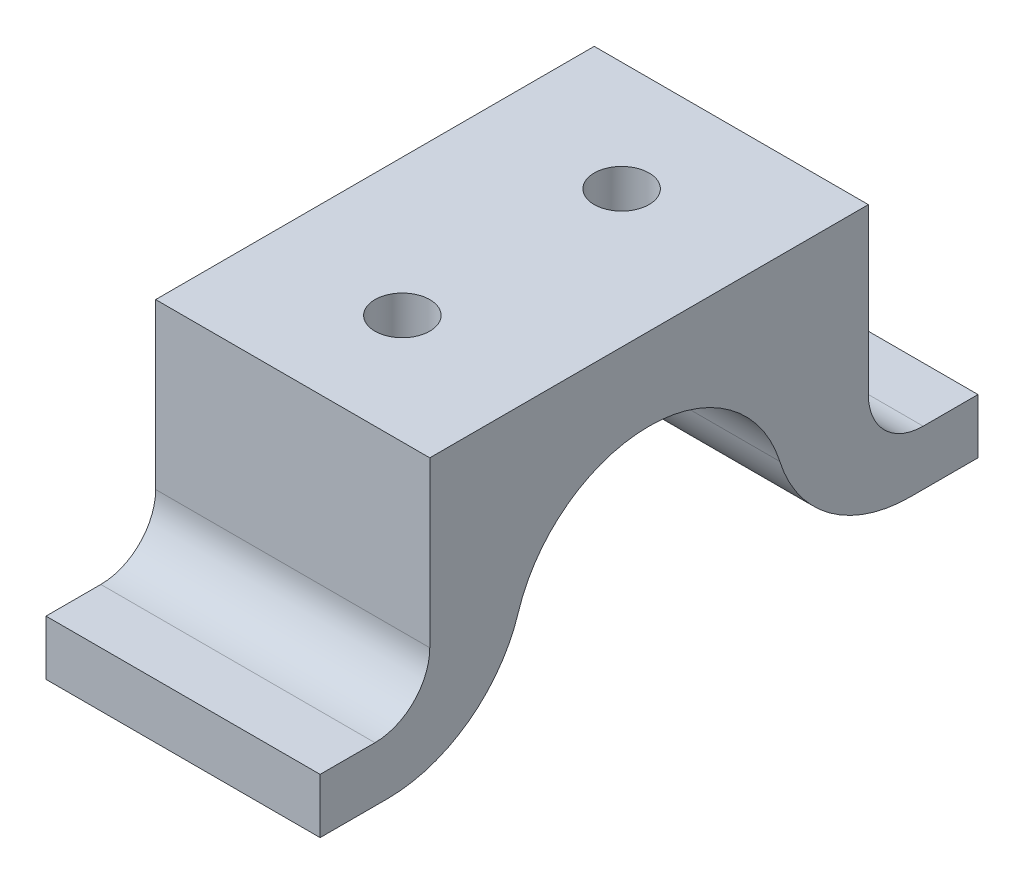
from build123d import *

# Parameters (mm, degrees)
SKETCH1_W           = 10
SKETCH1_H           = 16
BOSS_EXTRUDE1_DEPTH = 3
SKETCH2_W           = 10
SKETCH2_H           = 3
BOSS_EXTRUDE2_DEPTH = 5
SKETCH3_W           = 10
SKETCH3_H           = 7
BOSS_EXTRUDE3_DEPTH = 2
FILLET1_R           = 5
FILLET2_R           = 5
FILLET3_R           = 2
SKETCH4_R           = 1
CUT_EXTRUDE1_DEPTH  = 19.309833585


with BuildPart() as part:
    # Sketch1 → Boss-Extrude1 (new body)
    with BuildSketch(Plane.XZ.offset(-25)):
        with Locations((0, 2.5)):
            Rectangle(SKETCH1_W, SKETCH1_H)
    extrude(amount=BOSS_EXTRUDE1_DEPTH)

    # Sketch2 → Boss-Extrude2 (add)
    with BuildSketch(Plane.XZ.offset(-22)):
        with Locations((0, -4)):
            Rectangle(SKETCH2_W, SKETCH2_H)
        with Locations((0, 9)):
            Rectangle(SKETCH2_W, SKETCH2_H)
    extrude(amount=BOSS_EXTRUDE2_DEPTH)

    # Sketch3 → Boss-Extrude3 (add)
    with BuildSketch(Plane.XZ.offset(-17)):
        with Locations((0, 11)):
            Rectangle(SKETCH3_W, SKETCH3_H)
        with Locations((0, -6)):
            Rectangle(SKETCH3_W, SKETCH3_H)
    extrude(amount=BOSS_EXTRUDE3_DEPTH)

    # Fillet1
    fillet1_edges = [part.edges().sort_by_distance(p)[0] for p in [
        (0, 22, 7.5),
        (0, 22, -2.5),
    ]]
    fillet(fillet1_edges, radius=FILLET1_R - 0.0001)  # a hair under: the kernel refuses the full size

    # Fillet2
    fillet2_edges = [part.edges().sort_by_distance(p)[0] for p in [
        (0, 15, -2.5),
        (0, 15, 7.5),
    ]]
    fillet(fillet2_edges, radius=FILLET2_R)

    # Fillet3
    fillet3_edges = [part.edges().sort_by_distance(p)[0] for p in [
        (0, 17, -5.5),
        (0, 17, 10.5),
    ]]
    fillet(fillet3_edges, radius=FILLET3_R)

    # Sketch4 → Cut-Extrude1 (cut, through all)
    with BuildSketch(Plane(origin=(0, 25, 0), x_dir=(1, 0, 0), z_dir=(0, 1, 0))):
        with Locations(Location((0, 1.5, 0), (0, 0, 270))):
            Circle(SKETCH4_R)
        with Locations(Location((0, -6.5, 0), (0, 0, 270))):
            Circle(SKETCH4_R)
    extrude(amount=-CUT_EXTRUDE1_DEPTH, mode=Mode.SUBTRACT)


solid = part.part
